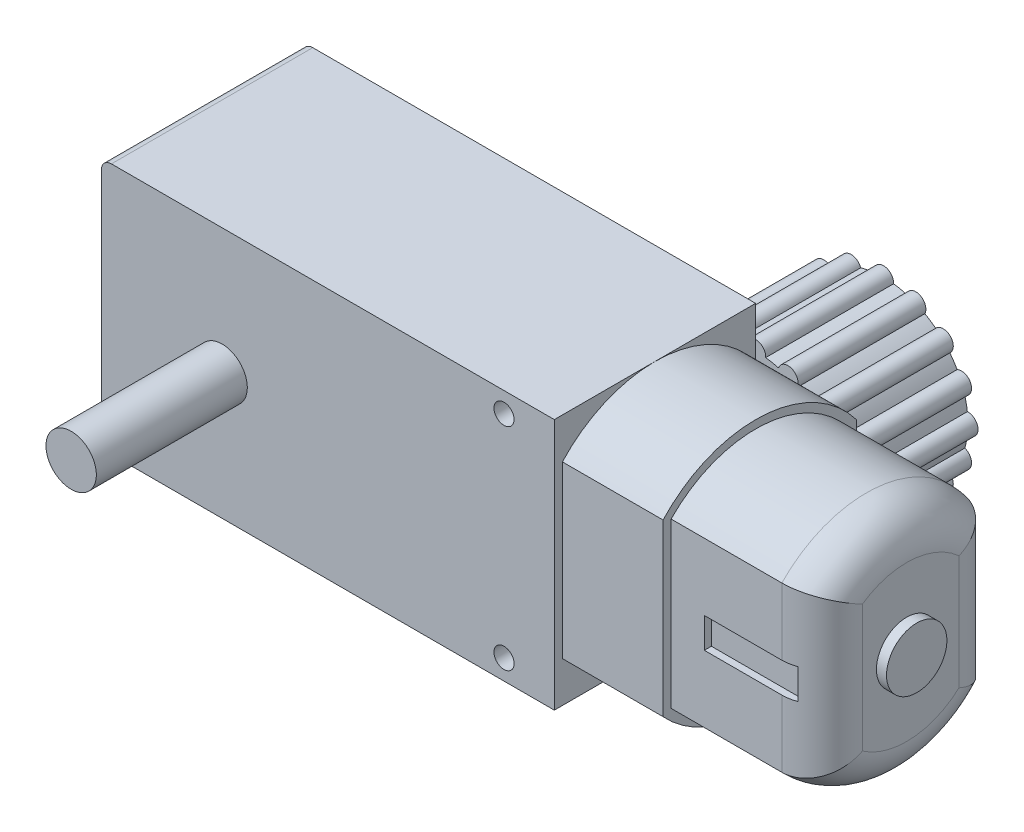
from build123d import *

# Parameters (mm, degrees)
BOSS_EXTRUDE1_DEPTH     = 10
CUT_EXTRUDE2_DEPTH      = 25
SKETCH4_W               = 2.420711262391846
SKETCH4_H               = 16.924538398432034
CUT_EXTRUDE3_DEPTH      = 25
CUT_EXTRUDE4_DEPTH      = 15.000000000000002
FILLET1_R               = 4
SKETCH6_R               = 3
BOSS_EXTRUDE2_DEPTH     = 1
SKETCH7_W               = 9.06468295299787
SKETCH7_H               = 3
CUT_EXTRUDE5_DEPTH      = 1.5
FILLET2_R               = 1
SKETCH8_R               = 1.500000000000004
BOSS_EXTRUDE3_DEPTH     = 1.75
CUT_EXTRUDE7_DEPTH      = 47.435439052516784
CUT_EXTRUDE7_DEPTH_BACK = 47.435439052516784
SKETCH9_R               = 1
SKETCH10_R              = 2.4999999999999982
CUT_EXTRUDE8_DEPTH      = 47.435439052516784
SKETCH11_R              = 8.39
BOSS_EXTRUDE5_DEPTH     = 12.7
BOSS_EXTRUDE6_START     = -12.7
BOSS_EXTRUDE6_DEPTH     = 12.7
SKETCH14_R              = 2.4999999999999982
BOSS_EXTRUDE7_DEPTH     = 35


with BuildPart() as part:
    # Sketch1 → Boss-Extrude1 (new, symmetric)
    with BuildSketch(Plane.XY):
        Polygon((34.99999999999999, -12.5), (-35.00000000000001, -12.500000000000005), (-35.00000000000001, 12.499999999999995), (34.99999999999999, 12.500000000000002), align=None)
    extrude(amount=BOSS_EXTRUDE1_DEPTH, both=True)

    # Sketch2 → Cut-Extrude2 (cut)
    with BuildSketch(Plane(origin=(34.99999999999999, 0, 0), x_dir=(0, 0, -1), z_dir=(1, 0, 0))):
        with BuildLine():
            Line((-10, 12.500000000000002), (-10, 7.500000000000002))
            ThreePointArc((-9.999999999999998, 7.500000000000003), (-5.590169943749482, 11.180339887498945), (-1.821e-14, 12.500000000000004))
            Line((-1.776e-14, 12.500000000000002), (-10, 12.500000000000002))
        make_face()
        with BuildLine():
            Line((10, 12.500000000000002), (-1.776e-14, 12.500000000000002))
            ThreePointArc((-1.821e-14, 12.500000000000004), (5.590169943749467, 11.180339887498956), (10, 7.500000000000001))
            Line((10, 7.500000000000002), (10, 12.500000000000002))
        make_face()
        with BuildLine():
            ThreePointArc((9.999999999999998, -7.500000000000003), (5.590169943749469, -11.180339887498953), (-1.554e-14, -12.5))
            Line((-1.599e-14, -12.5), (10, -12.5))
            Line((10, -12.5), (10, -7.500000000000002))
        make_face()
        with BuildLine():
            ThreePointArc((-1.554e-14, -12.5), (-5.590169943749482, -11.180339887498945), (-10, -7.500000000000001))
            Line((-10, -7.500000000000002), (-10, -12.5))
            Line((-10, -12.5), (-1.599e-14, -12.5))
        make_face()
    extrude(amount=-CUT_EXTRUDE2_DEPTH, mode=Mode.SUBTRACT)

    # Sketch4 → Cut-Extrude3 (cut)
    with BuildSketch(Plane(origin=(34.99999999999999, 0, 0), x_dir=(0, 0, -1), z_dir=(1, 0, 0))):
        with Locations((-10.41035563119592, 0)):
            Rectangle(SKETCH4_W, SKETCH4_H)
    extrude(amount=-CUT_EXTRUDE3_DEPTH, mode=Mode.SUBTRACT)

    # Sketch5 → Cut-Extrude4 (cut)
    with BuildSketch(Plane(origin=(34.99999999999999, 0, 0), x_dir=(0, 0, -1), z_dir=(1, 0, 0))):
        with BuildLine():
            Line((-9.199999999999998, 8.462269199216015), (-9.199999999999996, -8.462269199216017))
            ThreePointArc((-9.199999999999996, -8.462269199216017), (0.6256920192394629, -12.484330558626684), (10, -7.500000000000002))
            Line((10, -7.500000000000002), (10, 7.500000000000002))
            ThreePointArc((10, 7.500000000000002), (0.6256920192394629, 12.484330558626686), (-9.199999999999998, 8.462269199216015))
        make_face()
        with BuildLine():
            Line((-8.399999999999997, 8.144323176298942), (-8.399999999999997, -8.144323176298942))
            ThreePointArc((-8.399999999999997, -8.144323176298942), (0.608047219709459, -11.684189256367068), (9.2, -7.228416147400481))
            Line((9.2, -7.228416147400481), (9.2, 7.228416147400481))
            ThreePointArc((9.2, 7.228416147400481), (0.6080472197094615, 11.684189256367066), (-8.399999999999997, 8.144323176298942))
        make_face(mode=Mode.SUBTRACT)
    extrude(amount=-CUT_EXTRUDE4_DEPTH, mode=Mode.SUBTRACT)

    # Fillet1
    # the kernel refuses this fillet: 4 mm, written as the material it takes off along each edge
    with BuildSketch(Plane(origin=(34.99999999999999, -4.44e-15, 6.7e-16), x_dir=(0, -0.1880210929197643, -0.982164990527181), z_dir=(0, -0.982164990527181, 0.1880210929197643))) as fillet1_piece_1:
        with BuildLine():
            CenterArc((11.700000000000003 - FILLET1_R, -FILLET1_R), FILLET1_R, 0, 89.99999999999999)
            Line((11.700000000000003 - FILLET1_R, 0), (11.700000000000003, 0))
            Line((11.700000000000003, 0), (11.700000000000003, -FILLET1_R))
        make_face()
    revolve(axis=Axis((34.99999999999999, -4.44e-15, 6.7e-16), (1, 0, 0)), revolution_arc=195.71664993769073, mode=Mode.SUBTRACT)
    with BuildSketch(Plane(origin=(34.99999999999999, -17.22841614740048, -9.2), x_dir=(-1, 0, 0), z_dir=(0, 1, 0))) as fillet1_piece_2:
        with BuildLine():
            CenterArc((FILLET1_R, FILLET1_R), FILLET1_R, 180, 90)
            Line((0, FILLET1_R), (0, 0))
            Line((0, 0), (FILLET1_R, 0))
        make_face()
    extrude(amount=34.45683229480096, mode=Mode.SUBTRACT)
    with BuildSketch(Plane(origin=(34.99999999999999, 0, 6.7e-16), x_dir=(0, 0.0850574768635666, 0.9963760462945724), z_dir=(0, 0.9963760462945724, -0.0850574768635666))) as fillet1_piece_3:
        with BuildLine():
            CenterArc((11.700000000000003 - FILLET1_R, -FILLET1_R), FILLET1_R, 0, 90)
            Line((11.700000000000003 - FILLET1_R, 0), (11.700000000000003, 0))
            Line((11.700000000000003, 0), (11.700000000000003, -FILLET1_R))
        make_face()
    revolve(axis=Axis((34.99999999999999, 0, 6.7e-16), (1, 0, 0)), revolution_arc=195.71664993769085, mode=Mode.SUBTRACT)
    with BuildSketch(Plane(origin=(34.99999999999999, 18.14432317629894, 8.399999999999997), x_dir=(-1, 0, 0), z_dir=(0, -1, 0))) as fillet1_piece_4:
        with BuildLine():
            CenterArc((FILLET1_R, FILLET1_R), FILLET1_R, 180, 90)
            Line((0, FILLET1_R), (0, 0))
            Line((0, 0), (FILLET1_R, 0))
        make_face()
    extrude(amount=36.28864635259788, mode=Mode.SUBTRACT)

    # Sketch6 → Boss-Extrude2 (add)
    with BuildSketch(Plane(origin=(34.99999999999999, 0, 0), x_dir=(0, 0, -1), z_dir=(1, 0, 0))):
        with Locations(Location((0, 0, 0), (0, 0, 180))):
            Circle(SKETCH6_R)
    extrude(amount=BOSS_EXTRUDE2_DEPTH)

    # Sketch7 → Cut-Extrude5 (cut)
    with BuildSketch(Plane(origin=(0, 0, -9.2), x_dir=(-1, 0, 0), z_dir=(0, 0, -1))):
        with Locations((-27.832741428017933, 0)):
            Rectangle(SKETCH7_W, SKETCH7_H)
    cut_extrude5 = extrude(amount=-CUT_EXTRUDE5_DEPTH, mode=Mode.SUBTRACT)

    # Mirror1: Cut-Extrude5 across plane
    add(cut_extrude5.mirror(Plane.XY), mode=Mode.SUBTRACT)

    # Fillet2
    fillet2_edges = [part.edges().sort_by_distance(p)[0] for p in [
        (-35.00000000000001, 12.499999999999995, 0),
        (-35.00000000000001, -12.500000000000005, 0),
    ]]
    fillet(fillet2_edges, radius=FILLET2_R)

    # Sketch8 → Boss-Extrude3 (add, symmetric)
    with BuildSketch(Plane.XY):
        Polygon((-35.00000000000001, -2.4999999999999987), (-40.00000000000001, -2.499999999999998), (-40.00000000000001, 2.500000000000002), (-35.00000000000001, 2.4999999999999987), align=None)
        with Locations((-37.50000000000001, 2.17e-15)):
            Circle(SKETCH8_R, mode=Mode.SUBTRACT)
    extrude(amount=BOSS_EXTRUDE3_DEPTH, both=True)

    # Sketch9 → Cut-Extrude7 (cut, two sides: drawn at the far end of the back side and taken through both)
    with BuildSketch(Plane.XY.offset(10).offset(-CUT_EXTRUDE7_DEPTH_BACK)):
        with Locations(Location((4.99999999999999, -10.500000000000004, 0), (0, 0, 180))):
            Circle(SKETCH9_R)
        with Locations(Location((4.99999999999999, 10.500000000000004, 0), (0, 0, 180))):
            Circle(SKETCH9_R)
    extrude(amount=CUT_EXTRUDE7_DEPTH + CUT_EXTRUDE7_DEPTH_BACK, mode=Mode.SUBTRACT)

    # Sketch10 → Cut-Extrude8 (cut, through all)
    with BuildSketch(Plane(origin=(0, 0, -10), x_dir=(-1, 0, 0), z_dir=(0, 0, -1))):
        with Locations((23.00000000000001, 0)):
            Circle(SKETCH10_R)
    extrude(amount=-CUT_EXTRUDE8_DEPTH, mode=Mode.SUBTRACT)

    # Sketch11 → Boss-Extrude5 (add)
    with BuildSketch(Plane(origin=(0, 0, -10), x_dir=(-1, 0, 0), z_dir=(0, 0, -1))):
        with Locations(Location((-9.999999999999998, -1.3e-15, 0), (0, 0, 243.370213058))):
            Circle(SKETCH11_R)
    extrude(amount=BOSS_EXTRUDE5_DEPTH)

    # Sketch13 → Boss-Extrude6 (add)
    with BuildSketch(Plane(origin=(0, 0, -22.7), x_dir=(-1, 0, 0), z_dir=(0, 0, -1)).offset(BOSS_EXTRUDE6_START)):
        with BuildLine():
            ThreePointArc((-9.001777346932231, 8.330405244338497), (-9.999999999999995, 8.389999999999999), (-10.998222653067758, 8.330405244338497))
            ThreePointArc((-10.998222653067758, 8.330405244338497), (-9.999999999999995, 9.389999999999999), (-9.001777346932231, 8.330405244338497))
        make_face()
        with BuildLine():
            ThreePointArc((-5.889854450046044, 7.314287631628538), (-6.7892860024568655, 7.751349277769716), (-7.734329406162691, 8.078294173909544))
            ThreePointArc((-7.734329406162691, 8.078294173909544), (-6.406602570091955, 8.675228810280863), (-5.889854450046044, 7.314287631628538))
        make_face()
        with BuildLine():
            ThreePointArc((-3.4036639545781147, 5.184636031185651), (-4.067374105844959, 5.9326258941552705), (-4.8153639688146, 6.596336045422089))
            ThreePointArc((-4.8153639688146, 6.596336045422089), (-3.360267324658414, 6.639732675341834), (-3.4036639545781147, 5.184636031185651))
        make_face()
        with BuildLine():
            ThreePointArc((-1.9217058260904158, 2.265670593837173), (-2.2486507222303, 3.2107139975430976), (-2.6857123683715303, 4.110145549954018))
            ThreePointArc((-2.6857123683715303, 4.110145549954018), (-1.3247711897190175, 3.593397429908187), (-1.9217058260904158, 2.265670593837173))
        make_face()
        with BuildLine():
            ThreePointArc((-1.6695947556614985, -0.99822265306777), (-1.6099999999999959, -5.96e-15), (-1.669594755661497, 0.9982226530677578))
            ThreePointArc((-1.669594755661497, 0.9982226530677578), (-0.609999999999998, -6.09e-15), (-1.6695947556614985, -0.99822265306777))
        make_face()
        with BuildLine():
            ThreePointArc((-2.6857123683715347, -4.110145549954029), (-2.2486507222303036, -3.21071399754311), (-1.9217058260904158, -2.265670593837187))
            ThreePointArc((-1.9217058260904158, -2.265670593837187), (-1.32477118971902, -3.593397429908198), (-2.6857123683715347, -4.110145549954029))
        make_face()
        with BuildLine():
            ThreePointArc((-4.8153639688145145, -6.596336045421976), (-4.067374105844869, -5.932625894155138), (-3.4036639545780307, -5.1846360311854935))
            ThreePointArc((-3.4036639545780307, -5.1846360311854935), (-3.3602673246583237, -6.639732675341683), (-4.8153639688145145, -6.596336045421976))
        make_face()
        with BuildLine():
            ThreePointArc((-7.734329406162824, -8.078294173909585), (-6.789286002456899, -7.751349277769699), (-5.88985445004598, -7.314287631628469))
            ThreePointArc((-5.88985445004598, -7.314287631628469), (-6.406602570091808, -8.675228810280979), (-7.734329406162824, -8.078294173909585))
        make_face()
        with BuildLine():
            ThreePointArc((-10.998222653067767, -8.330405244338499), (-10.000000000000002, -8.39), (-9.001777346932236, -8.3304052443385))
            ThreePointArc((-9.001777346932236, -8.3304052443385), (-10, -9.39), (-10.998222653067767, -8.330405244338499))
        make_face()
        with BuildLine():
            ThreePointArc((-14.110145549954028, -7.314287631628465), (-13.210713997543106, -7.751349277769697), (-12.26567059383718, -8.078294173909583))
            ThreePointArc((-12.26567059383718, -8.078294173909583), (-13.593397429908197, -8.675228810280984), (-14.110145549954028, -7.314287631628465))
        make_face()
        with BuildLine():
            ThreePointArc((-16.596336045421967, -5.1846360311854855), (-15.932625894155128, -5.932625894155132), (-15.184636031185486, -6.596336045421974))
            ThreePointArc((-15.184636031185486, -6.596336045421974), (-16.63973267534168, -6.63973267534168), (-16.596336045421967, -5.1846360311854855))
        make_face()
        with BuildLine():
            ThreePointArc((-18.07829417390958, -2.26567059383718), (-17.751349277769695, -3.2107139975431056), (-17.314287631628464, -4.110145549954026))
            ThreePointArc((-17.314287631628464, -4.110145549954026), (-18.675228810280974, -3.5933974299081965), (-18.07829417390958, -2.26567059383718))
        make_face()
        with BuildLine():
            ThreePointArc((-18.330405244338493, 0.9982226530677667), (-18.389999999999993, 3.45e-15), (-18.330405244338493, -0.9982226530677624))
            ThreePointArc((-18.330405244338493, -0.9982226530677624), (-19.39, 2e-15), (-18.330405244338493, 0.9982226530677667))
        make_face()
        with BuildLine():
            ThreePointArc((-17.314287631628464, 4.110145549954029), (-17.751349277769695, 3.210713997543108), (-18.07829417390958, 2.265670593837187))
            ThreePointArc((-18.07829417390958, 2.265670593837187), (-18.675228810280977, 3.5933974299081974), (-17.314287631628464, 4.110145549954029))
        make_face()
        with BuildLine():
            ThreePointArc((-15.18463603118538, 6.596336045422069), (-15.932625894155038, 5.932625894155242), (-16.596336045421882, 5.184636031185604))
            ThreePointArc((-16.596336045421882, 5.184636031185604), (-16.63973267534157, 6.639732675341801), (-15.18463603118538, 6.596336045422069))
        make_face()
        with BuildLine():
            ThreePointArc((-12.265670593837033, 8.078294173909628), (-13.210713997542964, 7.75134927776976), (-14.110145549953884, 7.314287631628539))
            ThreePointArc((-14.110145549953884, 7.314287631628539), (-13.593397429908032, 8.675228810281054), (-12.265670593837033, 8.078294173909628))
        make_face()
    extrude(amount=BOSS_EXTRUDE6_DEPTH)

    # Sketch14 → Boss-Extrude7 (add)
    with BuildSketch(Plane(origin=(0, 0, -10), x_dir=(-1, 0, 0), z_dir=(0, 0, -1))):
        with Locations((23.00000000000001, 0)):
            Circle(SKETCH14_R)
    extrude(amount=-BOSS_EXTRUDE7_DEPTH)


solid = part.part
